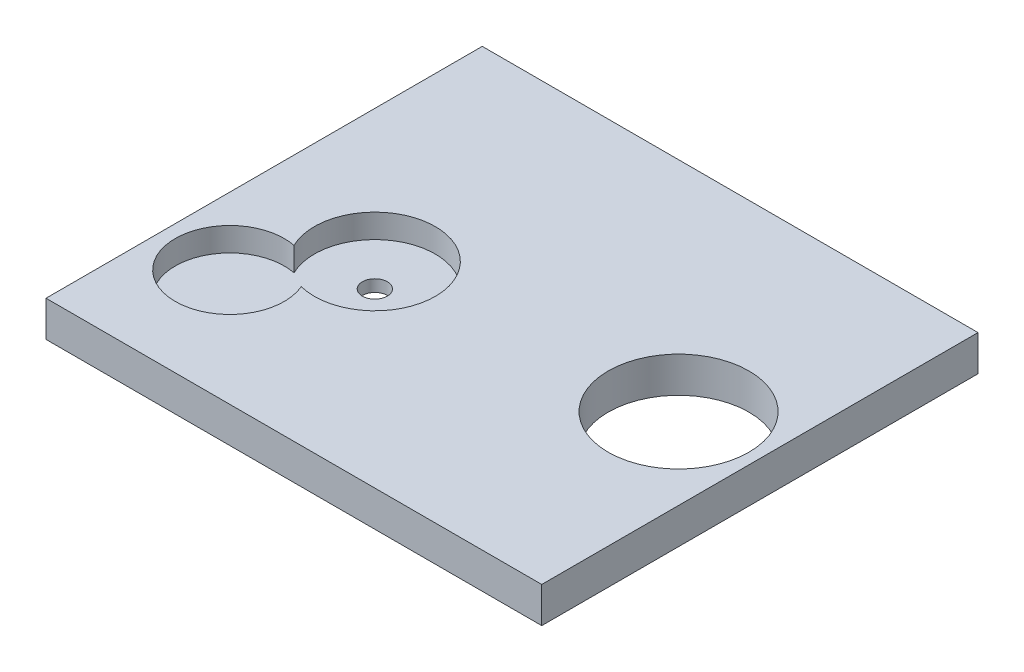
from build123d import *

# Parameters (mm, degrees)
SKETCH1_W               = 125
SKETCH1_H               = 110
TOP_BASE_DEPTH          = 9
GEARS_EXTRUDE_CUT_DEPTH = 6
SKETCH7_R               = 3.15
KEY_EXTRUDE_CUT_DEPTH   = 167.751311839
SKETCH8_R               = 17.75
CUT_EXTRUDE3_DEPTH      = 167.751311839


with BuildPart() as part:
    # Sketch1 → Top_Base (new body)
    with BuildSketch(Plane(origin=(0, 0, 0), x_dir=(1, 0, 0), z_dir=(0, 1, 0))):
        with Locations((62.5, 55)):
            Rectangle(SKETCH1_W, SKETCH1_H)
    extrude(amount=TOP_BASE_DEPTH)

    # Sketch5 → Gears_Extrude_Cut (cut)
    with BuildSketch(Plane(origin=(0, 9, 0), x_dir=(1, 0, 0), z_dir=(0, 1, 0))):
        with BuildLine():
            ThreePointArc((29.656191237, 34.709719453), (43.06910259, 61.303576489), (19.717894906, 42.814105898))
            ThreePointArc((19.717894906, 42.814105898), (8.310299137, 18.679339459), (29.656191237, 34.709719453))
        make_face()
    extrude(amount=-GEARS_EXTRUDE_CUT_DEPTH, mode=Mode.SUBTRACT)

    # Sketch7 → Key_Extrude_Cut (cut, through all)
    with BuildSketch(Plane(origin=(0, 9, 0), x_dir=(1, 0, 0), z_dir=(0, 1, 0))):
        with Locations((33.43143436, 49.48503804)):
            Circle(SKETCH7_R)
    extrude(amount=-KEY_EXTRUDE_CUT_DEPTH, mode=Mode.SUBTRACT)

    # Sketch8 → Cut-Extrude3 (cut, through all)
    with BuildSketch(Plane(origin=(0, 9, 0), x_dir=(1, 0, 0), z_dir=(0, 1, 0))):
        with Locations((104.5, 55)):
            Circle(SKETCH8_R)
    extrude(amount=-CUT_EXTRUDE3_DEPTH, mode=Mode.SUBTRACT)


solid = part.part
